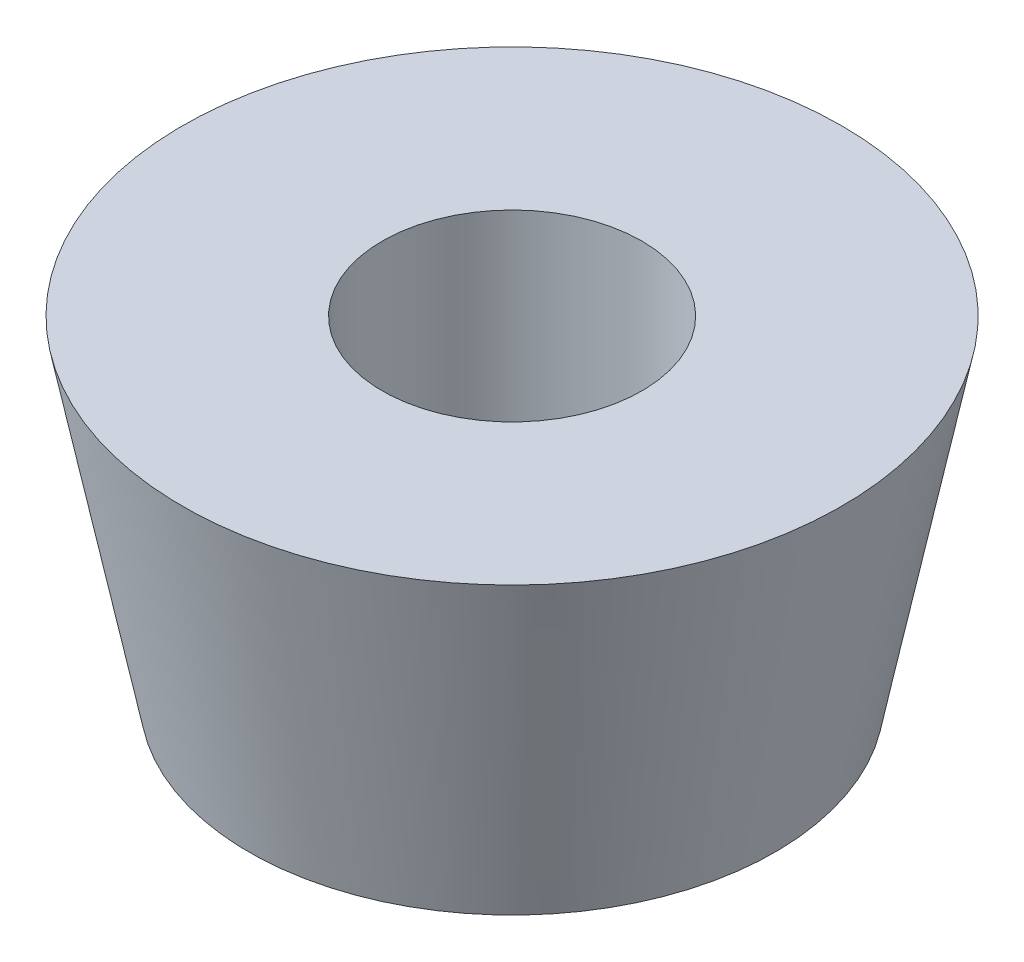
from build123d import *


with BuildPart() as part:
    # Sketch1 → Revolve1 (revolve)
    with BuildSketch(Plane.XY):
        Polygon((1.95, 0), (3.95, 0), (4.95, 5), (1.95, 5), align=None)
    revolve(axis=Axis((0, 0, 0), (0, 1, 0)))


solid = part.part
